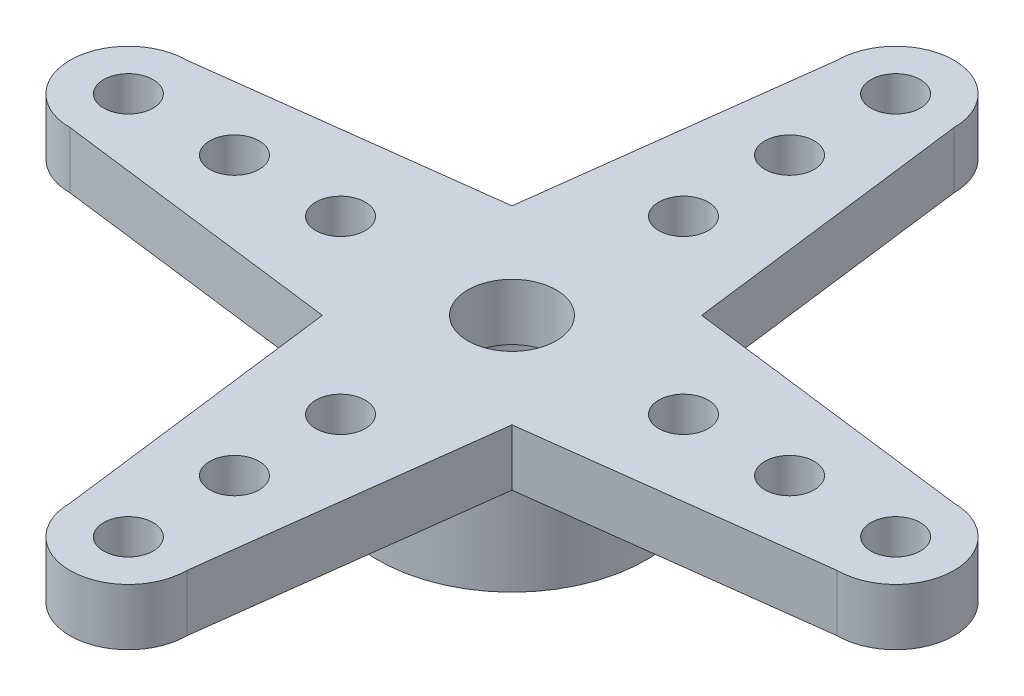
from build123d import *

# Parameters (mm, degrees)
SKETCH1_R           = 0.7
SKETCH1_R_2         = 1.25
BOSS_EXTRUDE1_DEPTH = 1.6
SKETCH2_R           = 3.792840445
SKETCH2_R_2         = 2.43
BOSS_EXTRUDE2_DEPTH = 2.5


with BuildPart() as part:
    # Sketch1 → Boss-Extrude1 (new body)
    with BuildSketch(Plane(origin=(0, 0, 0), x_dir=(1, 0, 0), z_dir=(0, 1, 0))):
        with BuildLine():
            Line((-10.84721718, -1.650301895), (-2.681943198, -2.681943198))
            Line((-2.681943198, -2.681943198), (-1.650301895, -10.84721718))
            ThreePointArc((-1.650301895, -10.84721718), (0, -12.5), (1.650301895, -10.84721718))
            Line((1.650301895, -10.84721718), (2.681943198, -2.681943198))
            Line((2.681943198, -2.681943198), (10.84721718, -1.650301895))
            ThreePointArc((10.84721718, -1.650301895), (12.5, 0), (10.84721718, 1.650301895))
            Line((10.84721718, 1.650301895), (2.681943198, 2.681943198))
            Line((2.681943198, 2.681943198), (1.650301895, 10.84721718))
            ThreePointArc((1.650301895, 10.84721718), (0, 12.5), (-1.650301895, 10.84721718))
            Line((-1.650301895, 10.84721718), (-2.681943198, 2.681943198))
            Line((-2.681943198, 2.681943198), (-10.84721718, 1.650301895))
            ThreePointArc((-10.84721718, 1.650301895), (-12.5, 0), (-10.84721718, -1.650301895))
        make_face()
        with Locations((0, 4.849696243)):
            Circle(SKETCH1_R, mode=Mode.SUBTRACT)
        with Locations((0, 7.849696243)):
            Circle(SKETCH1_R, mode=Mode.SUBTRACT)
        with Locations((0, 10.849696243)):
            Circle(SKETCH1_R, mode=Mode.SUBTRACT)
        with Locations((0, -4.849696243)):
            Circle(SKETCH1_R, mode=Mode.SUBTRACT)
        with Locations((0, -7.849696243)):
            Circle(SKETCH1_R, mode=Mode.SUBTRACT)
        with Locations((0, -10.849696243)):
            Circle(SKETCH1_R, mode=Mode.SUBTRACT)
        with Locations((-10.849696243, 0)):
            Circle(SKETCH1_R, mode=Mode.SUBTRACT)
        with Locations((-7.849696243, 0)):
            Circle(SKETCH1_R, mode=Mode.SUBTRACT)
        with Locations((-4.849696243, 0)):
            Circle(SKETCH1_R, mode=Mode.SUBTRACT)
        with Locations((10.849696243, 0)):
            Circle(SKETCH1_R, mode=Mode.SUBTRACT)
        with Locations((4.849696243, 0)):
            Circle(SKETCH1_R, mode=Mode.SUBTRACT)
        with Locations((7.849696243, 0)):
            Circle(SKETCH1_R, mode=Mode.SUBTRACT)
        Circle(SKETCH1_R_2, mode=Mode.SUBTRACT)
    extrude(amount=BOSS_EXTRUDE1_DEPTH)

    # Sketch2 → Boss-Extrude2 (add)
    with BuildSketch(Plane.XZ):
        Circle(SKETCH2_R)
        Circle(SKETCH2_R_2, mode=Mode.SUBTRACT)
    extrude(amount=BOSS_EXTRUDE2_DEPTH)


solid = part.part
